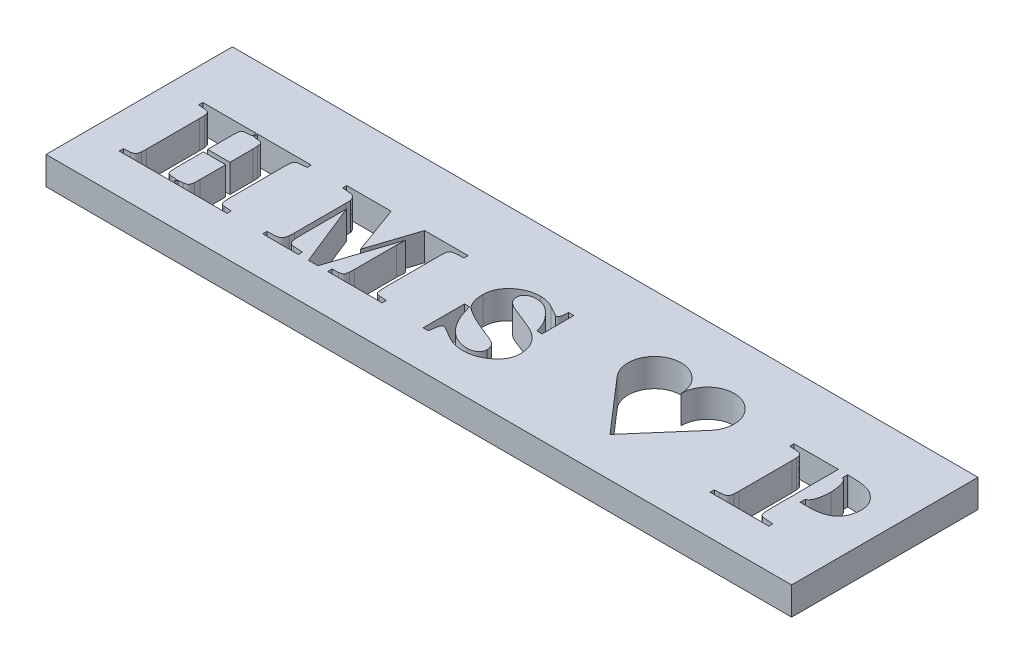
from build123d import *

# Parameters (mm, degrees)
SKETCH1_W           = 40
SKETCH1_H           = 10
BOSS_EXTRUDE1_DEPTH = 1.5
CUT_EXTRUDE1_START  = -1.5
CUT_EXTRUDE1_DEPTH  = 1.5
SKETCH4_W           = 0.5
SKETCH4_H           = 1.5
BOSS_EXTRUDE4_DEPTH = 3.5


# Read off the part's stored shape, not the designer's step: Cut-Extrude1
with BuildPart() as part:
    # Sketch1 → Boss-Extrude1 (new body)
    with BuildSketch(Plane(origin=(0, 0, 0), x_dir=(1, 0, 0), z_dir=(0, 1, 0))):
        Rectangle(SKETCH1_W, SKETCH1_H)
    extrude(amount=BOSS_EXTRUDE1_DEPTH)

    # Cut-Extrude1 outline → Cut-Extrude1 (cut)
    # profile 1 of 5: a face of its own
    with BuildSketch(Plane(origin=(0, 1.5, 0), x_dir=(1, 0, 0), z_dir=(0, 1, 0)).offset(CUT_EXTRUDE1_START)):
        with BuildLine():
            add(Edge.make_bspline(
                [(13.751780063, -2.651920037), (13.791225125, -2.646392107), (13.868290536, -2.635591968), (13.963177903, -2.624961797), (14.034165584, -2.614072675), (14.079340021, -2.59712884), (14.118712332, -2.57724694), (14.151816613, -2.549010475), (14.178865726, -2.510175688), (14.198441761, -2.457969123), (14.212947371, -2.392618841), (14.218633224, -2.344340467), (14.221716772, -2.31815817)],
                knots=[0, 0, 0, 0, 0.17998444, 0.351642879, 0.432127665, 0.503392336, 0.568787835, 0.630606754, 0.697953168, 0.780380817, 0.880896263, 1, 1, 1, 1], degree=3))
            Line((13.751780063, -2.651920037), (13.509691456, -2.651920037))
            Line((13.509691456, -2.651920037), (13.509691456, -2.879768138))
            Line((13.509691456, -2.879768138), (16.658623418, -2.879768138))
            Line((16.658623418, -2.879768138), (16.658623418, -2.665270511))
            add(Edge.make_bspline(
                [(15.896756329, -2.314598043), (15.900029258, -2.343182675), (15.906006646, -2.395387134), (15.922033115, -2.464765372), (15.939872112, -2.519211585), (15.96640644, -2.557948301), (15.999399172, -2.584460119), (16.038113328, -2.603640436), (16.083803584, -2.617942568), (16.155030415, -2.63008692), (16.252584508, -2.638699696), (16.377635211, -2.644398726), (16.514189019, -2.648443099), (16.608837664, -2.659470194), (16.658623418, -2.665270511)],
                knots=[0, 0, 0, 0, 0.089334166, 0.163152069, 0.221218087, 0.266243072, 0.306859461, 0.351400241, 0.399810796, 0.45515502, 0.575632115, 0.703973068, 0.844288063, 1, 1, 1, 1], degree=3))
            Line((15.896756329, -2.314598043), (15.885185918, -2.040468296))
            Line((15.885185918, -2.040468296), (15.886075949, -0.938609119))
            add(Edge.make_bspline(
                [(16.818829114, -0.931488866), (16.755933284, -0.93139613), (16.636667769, -0.931220281), (16.467563374, -0.932389361), (16.317740054, -0.933146761), (16.187798693, -0.93424693), (16.079200037, -0.934488299), (15.99377694, -0.936941916), (15.932055636, -0.937436976), (15.898832543, -0.93828392), (15.886075949, -0.938609119)],
                knots=[0, 0, 0, 0, 0.202279889, 0.383570981, 0.543871091, 0.684134449, 0.801498829, 0.893117146, 0.958960439, 1, 1, 1, 1], degree=3))
            add(Edge.make_bspline(
                [(18.392405063, 0.356386925), (18.391359033, 0.312138933), (18.389274149, 0.223946444), (18.373072447, 0.092814518), (18.344889972, -0.03622911), (18.307278625, -0.162464363), (18.258855092, -0.284066869), (18.192943887, -0.395101823), (18.116994611, -0.498734998), (18.025135353, -0.590083403), (17.922068452, -0.672028245), (17.806563482, -0.741921834), (17.680333857, -0.802133314), (17.5411882, -0.85024928), (17.386961757, -0.888123144), (17.214338527, -0.912476644), (17.022963582, -0.928887903), (16.888884315, -0.930596263), (16.818829114, -0.931488866)],
                knots=[0, 0, 0, 0, 0.057065209, 0.11373901, 0.17010708, 0.227250505, 0.283534078, 0.33840533, 0.393357922, 0.448830372, 0.504949787, 0.562836689, 0.62257612, 0.685026518, 0.752409338, 0.82709527, 0.909658846, 1, 1, 1, 1], degree=3))
            add(Edge.make_bspline(
                [(16.387163766, 1.625572052), (16.469945608, 1.624913788), (16.628464222, 1.623653282), (16.855657809, 1.613508842), (17.061355359, 1.594568677), (17.246101271, 1.570809093), (17.40911294, 1.538194509), (17.551189501, 1.498783864), (17.671978275, 1.451387525), (17.773139289, 1.395918911), (17.858199713, 1.335092928), (17.936129403, 1.275570618), (18.007028534, 1.215165002), (18.071983609, 1.154704685), (18.128557351, 1.092349215), (18.17918369, 1.0296029), (18.222653761, 0.965901907), (18.27101742, 0.880326964), (18.320012523, 0.771184349), (18.362070748, 0.635853255), (18.388006391, 0.497118847), (18.390936527, 0.40337153), (18.392405063, 0.356386925)],
                knots=[0, 0, 0, 0, 0.092479581, 0.177088773, 0.253965738, 0.323197368, 0.385077075, 0.439526139, 0.487716456, 0.529694894, 0.56803394, 0.604428348, 0.639227337, 0.672051015, 0.703486614, 0.733197595, 0.762062811, 0.789523871, 0.84293001, 0.895344802, 0.947548545, 1, 1, 1, 1], degree=3))
            Line((16.387163766, 1.625572052), (13.503461234, 1.620231862))
            Line((13.503461234, 1.620231862), (13.503461234, 1.395943887))
            add(Edge.make_bspline(
                [(14.221716772, 1.05150164), (14.218601565, 1.077662245), (14.212891484, 1.125613844), (14.198741768, 1.191427423), (14.176618553, 1.243448498), (14.14926121, 1.284474566), (14.113825655, 1.314112309), (14.072279487, 1.337527043), (14.022355586, 1.354069807), (13.947816379, 1.368062576), (13.854077188, 1.377926046), (13.742338101, 1.38398867), (13.62649742, 1.387438762), (13.546464322, 1.392971212), (13.503461234, 1.395943887)],
                knots=[0, 0, 0, 0, 0.086557298, 0.158656916, 0.220210345, 0.271308782, 0.318983879, 0.370480407, 0.427190938, 0.490838204, 0.619343219, 0.736492367, 0.858413057, 1, 1, 1, 1], degree=3))
            Line((14.221716772, 1.05150164), (14.234177215, 0.779151957))
            Line((14.234177215, 0.779151957), (14.234177215, -2.046698518))
            Line((14.234177215, -2.046698518), (14.221716772, -2.31815817))
        make_face()
        with BuildLine():
            add(Edge.make_bspline(
                [(16.740506329, 0.362617147), (16.73954769, 0.41665525), (16.737641431, 0.52411026), (16.720267257, 0.683599813), (16.691541946, 0.839952686), (16.659331847, 0.966407822), (16.629160988, 1.062645605), (16.602478831, 1.126131948), (16.574079163, 1.182597764), (16.542260027, 1.230244174), (16.508287391, 1.27090348), (16.470284743, 1.30168124), (16.430966476, 1.327467248), (16.344805585, 1.354362562), (16.213531576, 1.378895478), (16.070165314, 1.388449725), (15.969450131, 1.39059354), (15.91929289, 1.391090136), (15.894382169, 1.392060277), (15.886075949, 1.392383761)],
                knots=[0, 0, 0, 0, 0.101326501, 0.201488203, 0.300479219, 0.399268288, 0.446075168, 0.489477233, 0.52830041, 0.564413111, 0.5967631, 0.627184468, 0.655909756, 0.684244353, 0.795444025, 0.905934202, 0.953244414, 0.984409838, 1, 1, 1, 1], degree=3))
            add(Edge.make_bspline(
                [(15.886075949, -0.715211176), (15.889919625, -0.714242435), (15.902735991, -0.711012261), (15.930021835, -0.709767113), (15.972052886, -0.706535221), (16.028269116, -0.704893573), (16.096480571, -0.699009607), (16.174988646, -0.691657574), (16.262027697, -0.67797164), (16.34011759, -0.667229382), (16.404213234, -0.65079373), (16.450672732, -0.630113232), (16.493104572, -0.6000436), (16.531117921, -0.561219349), (16.566346402, -0.514872784), (16.598348392, -0.460660381), (16.62543019, -0.397514752), (16.659148084, -0.302057525), (16.691437673, -0.170923464), (16.719714365, -0.003417998), (16.738152488, 0.175598833), (16.73970666, 0.29908154), (16.740506329, 0.362617147)],
                knots=[0, 0, 0, 0, 0.007235509, 0.024126103, 0.049667218, 0.084414085, 0.126840348, 0.17481383, 0.228501197, 0.287880137, 0.318797379, 0.349138474, 0.380283191, 0.413262574, 0.448081315, 0.486494571, 0.528013384, 0.573468444, 0.67146271, 0.774351508, 0.883896991, 1, 1, 1, 1], degree=3))
            Line((15.886075949, -0.715211176), (15.886075949, 1.392383761))
        make_face(mode=Mode.SUBTRACT)
    # profile 2 of 5: a face of its own
    with BuildSketch(Plane(origin=(0, 1.5, 0), x_dir=(1, 0, 0), z_dir=(0, 1, 0)).offset(CUT_EXTRUDE1_START)):
        with BuildLine():
            add(Edge.make_bspline(
                [(-0.746835443, 0.993649584), (-0.74536001, 0.95842561), (-0.74249664, 0.890066537), (-0.71357404, 0.793357329), (-0.668669437, 0.705995609), (-0.603755642, 0.631635803), (-0.527420634, 0.567156181), (-0.445570191, 0.506667308), (-0.356004261, 0.454420477), (-0.25734597, 0.407073125), (-0.144667653, 0.360479114), (-0.013883882, 0.308281701), (0.137444834, 0.248222158), (0.308051562, 0.183948023), (0.491479239, 0.113524641), (0.6810593, 0.035060839), (0.873906708, -0.049940556), (1.036966169, -0.123406026), (1.166770258, -0.18671078), (1.260009579, -0.241691302), (1.34885612, -0.302101642), (1.433592047, -0.368097492), (1.513873299, -0.439441978), (1.589901358, -0.516508727), (1.661850119, -0.598899601), (1.728524322, -0.686893583), (1.788876412, -0.779372907), (1.843064278, -0.875473692), (1.886977569, -0.976281789), (1.924099957, -1.080248302), (1.952159892, -1.187816566), (1.97315274, -1.29897335), (1.984349061, -1.413952778), (1.986335531, -1.491890867), (1.987341772, -1.531370195)],
                knots=[0, 0, 0, 0, 0.026271138, 0.050984329, 0.074800032, 0.099199579, 0.124200839, 0.149448905, 0.175206422, 0.201598111, 0.231222891, 0.266362204, 0.306898554, 0.352960473, 0.402685656, 0.453811837, 0.506362542, 0.560266849, 0.587549755, 0.614297078, 0.64112432, 0.667838504, 0.694551766, 0.721376256, 0.748735718, 0.776288763, 0.803854307, 0.831262293, 0.858674767, 0.885968494, 0.913734162, 0.941711718, 0.970474228, 1, 1, 1, 1], degree=3))
            add(Edge.make_bspline(
                [(-0.202136076, 1.449345786), (-0.234013839, 1.447723663), (-0.298004884, 1.444467432), (-0.39279841, 1.420267455), (-0.484917774, 1.380392708), (-0.572263029, 1.327489082), (-0.649550989, 1.262385069), (-0.706636807, 1.18288901), (-0.741484666, 1.091590917), (-0.745019546, 1.026888002), (-0.746835443, 0.993649584)],
                knots=[0, 0, 0, 0, 0.121610338, 0.244119151, 0.370969357, 0.503632024, 0.632866389, 0.753858137, 0.873554906, 1, 1, 1, 1], degree=3))
            add(Edge.make_bspline(
                [(1.374109968, -0.031666872), (1.366252482, -0.00491851), (1.349324649, 0.052707016), (1.318896671, 0.143670451), (1.282854018, 0.245684404), (1.242135678, 0.359117718), (1.187943269, 0.483058575), (1.111420705, 0.613435213), (1.012804652, 0.750848998), (0.897967234, 0.891908944), (0.774700527, 1.027880985), (0.647559053, 1.146348937), (0.522471806, 1.244702954), (0.394835115, 1.321584863), (0.261617118, 1.380230712), (0.117943026, 1.420972334), (-0.038145377, 1.44510274), (-0.146272122, 1.447900379), (-0.202136076, 1.449345786)],
                knots=[0, 0, 0, 0, 0.035906866, 0.077356214, 0.123523959, 0.175272454, 0.232580615, 0.297470079, 0.369568945, 0.450258278, 0.531668307, 0.605756047, 0.673860524, 0.736251134, 0.797168506, 0.860787532, 0.92807553, 1, 1, 1, 1], degree=3))
            Line((1.374109968, -0.031666872), (1.64556962, -0.031666872))
            Line((1.64556962, -0.031666872), (1.64556962, 1.677193887))
            Line((1.64556962, 1.677193887), (1.360759494, 1.677193887))
            add(Edge.make_bspline(
                [(1.178303006, 1.164535659), (1.192872855, 1.16611171), (1.222179591, 1.169281879), (1.261974291, 1.195146357), (1.293186389, 1.236979688), (1.318646727, 1.293485071), (1.337323053, 1.366025505), (1.351001358, 1.454845522), (1.35973843, 1.56042975), (1.360403904, 1.636530286), (1.360759494, 1.677193887)],
                knots=[0, 0, 0, 0, 0.073703244, 0.148251473, 0.233102023, 0.336401283, 0.461618154, 0.612966137, 0.793192121, 1, 1, 1, 1], degree=3))
            Line((1.178303006, 1.164535659), (0.583761867, 1.497407495))
            add(Edge.make_bspline(
                [(-0.151404272, 1.677193887), (-0.088669325, 1.674811072), (0.036760548, 1.670046961), (0.223461219, 1.636204065), (0.407108198, 1.579076769), (0.524376168, 1.524862271), (0.583761867, 1.497407495)],
                knots=[0, 0, 0, 0, 0.246456156, 0.49275509, 0.74312599, 1, 1, 1, 1], degree=3))
            add(Edge.make_bspline(
                [(-1.772151899, 0.21309183), (-1.770584598, 0.263318996), (-1.767488695, 0.362533112), (-1.743736956, 0.508230636), (-1.705228705, 0.648151664), (-1.65210364, 0.782405892), (-1.581383277, 0.909612003), (-1.496616821, 1.031214238), (-1.395830924, 1.146385972), (-1.282070313, 1.254886716), (-1.157864776, 1.35293449), (-1.028274161, 1.440388709), (-0.893451668, 1.513453288), (-0.754060649, 1.57338875), (-0.609880315, 1.620170959), (-0.46104509, 1.652343669), (-0.307809254, 1.674269383), (-0.203994346, 1.676210543), (-0.151404272, 1.677193887)],
                knots=[0, 0, 0, 0, 0.062204273, 0.122872591, 0.182349013, 0.241728823, 0.301276751, 0.362251589, 0.425042733, 0.490555683, 0.556740526, 0.620861198, 0.684017035, 0.74641971, 0.80860552, 0.871475145, 0.934892476, 1, 1, 1, 1], degree=3))
            add(Edge.make_bspline(
                [(-1.299545095, -0.858506271), (-1.337294966, -0.833309104), (-1.412645338, -0.783014473), (-1.50885915, -0.685490655), (-1.592233855, -0.574408744), (-1.657649818, -0.445982441), (-1.709456485, -0.303075208), (-1.746267496, -0.144762208), (-1.768712504, 0.029100011), (-1.770974832, 0.150124171), (-1.772151899, 0.21309183)],
                knots=[0, 0, 0, 0, 0.110755835, 0.221073428, 0.333112562, 0.449304402, 0.572116466, 0.704119735, 0.846056458, 1, 1, 1, 1], degree=3))
            add(Edge.make_bspline(
                [(0.905063291, -2.25318586), (0.903638351, -2.215668361), (0.900927406, -2.144291419), (0.87744058, -2.04314882), (0.838314346, -1.954006155), (0.779669218, -1.875399333), (0.699005258, -1.803819236), (0.591835205, -1.736708201), (0.458422197, -1.666880931), (0.29850886, -1.600971646), (0.122358616, -1.531570348), (-0.062505211, -1.457751458), (-0.25350044, -1.380752915), (-0.451637308, -1.301633817), (-0.656204154, -1.21307565), (-0.86491792, -1.107577365), (-1.081888599, -0.990930949), (-1.225767948, -0.903393123), (-1.299545095, -0.858506271)],
                knots=[0, 0, 0, 0, 0.041215804, 0.078412958, 0.113463202, 0.147527654, 0.185409671, 0.231382499, 0.286256452, 0.350862845, 0.421448381, 0.494517961, 0.569768794, 0.647928615, 0.729160766, 0.814813628, 0.905041812, 1, 1, 1, 1], degree=3))
            add(Edge.make_bspline(
                [(0.299841772, -2.708882062), (0.342972755, -2.707136062), (0.425856079, -2.703780833), (0.543912079, -2.679370402), (0.648605233, -2.635925879), (0.738241526, -2.576467933), (0.811054726, -2.505819446), (0.865750025, -2.428129845), (0.898890077, -2.342617796), (0.902996322, -2.283130238), (0.905063291, -2.25318586)],
                knots=[0, 0, 0, 0, 0.153956857, 0.295853595, 0.427853137, 0.556237336, 0.677585662, 0.788058432, 0.893314524, 1, 1, 1, 1], degree=3))
            add(Edge.make_bspline(
                [(-1.56210443, -0.715211176), (-1.553270159, -0.745491974), (-1.534105484, -0.811181788), (-1.501464417, -0.917420743), (-1.465370947, -1.039860605), (-1.42450843, -1.178196528), (-1.37192461, -1.330019444), (-1.299271269, -1.491990632), (-1.210706271, -1.665713384), (-1.107591439, -1.847655387), (-0.987903058, -2.027571665), (-0.847811739, -2.19235002), (-0.69200729, -2.339964983), (-0.549798186, -2.448814862), (-0.428537427, -2.524803854), (-0.333637698, -2.573597317), (-0.236172142, -2.616333518), (-0.134868267, -2.649265996), (-0.030741784, -2.67691872), (0.07685647, -2.694798257), (0.187409631, -2.707156805), (0.26212859, -2.708303358), (0.299841772, -2.708882062)],
                knots=[0, 0, 0, 0, 0.032058659, 0.069546626, 0.112955303, 0.161793716, 0.216152654, 0.276098588, 0.342040466, 0.414297442, 0.48856181, 0.561299738, 0.633604513, 0.706334941, 0.742899623, 0.77890806, 0.814699962, 0.850933678, 0.887061852, 0.924092282, 0.96168681, 1, 1, 1, 1], degree=3))
            Line((-1.56210443, -0.715211176), (-1.829113924, -0.715211176))
            Line((-1.829113924, -0.715211176), (-1.829113924, -2.936730163))
            Line((-1.829113924, -2.936730163), (-1.552314082, -2.936730163))
            add(Edge.make_bspline(
                [(-1.321795886, -2.310147885), (-1.338073421, -2.311374451), (-1.369558207, -2.313746935), (-1.412760509, -2.336774587), (-1.444107136, -2.376220962), (-1.463878713, -2.417990381), (-1.475933731, -2.460596388), (-1.485384881, -2.502597884), (-1.496249944, -2.553247493), (-1.506778845, -2.612934215), (-1.517041751, -2.681285437), (-1.529114278, -2.758308481), (-1.540198542, -2.844458415), (-1.548146251, -2.904988032), (-1.552314082, -2.936730163)],
                knots=[0, 0, 0, 0, 0.06776762, 0.131079364, 0.198000285, 0.275177456, 0.323096399, 0.383019194, 0.455330472, 0.539828243, 0.636570394, 0.74454424, 0.866037313, 1, 1, 1, 1], degree=3))
            add(Edge.make_bspline(
                [(0.282041139, -2.936730163), (0.237508146, -2.935551227), (0.148815224, -2.933203232), (0.016001476, -2.918915356), (-0.115270458, -2.893514907), (-0.246390826, -2.859933425), (-0.375731015, -2.814942338), (-0.504849579, -2.76169424), (-0.631898955, -2.697034862), (-0.755523834, -2.625245695), (-0.870499752, -2.552069173), (-0.976400028, -2.489246695), (-1.067169195, -2.434455229), (-1.14524722, -2.391457136), (-1.20783822, -2.355408793), (-1.258281757, -2.332272507), (-1.293755696, -2.314709063), (-1.314300334, -2.311367154), (-1.321795886, -2.310147885)],
                knots=[0, 0, 0, 0, 0.076481606, 0.152322503, 0.229061601, 0.305922368, 0.38454598, 0.464023294, 0.54559101, 0.629131657, 0.709435825, 0.779596701, 0.84058432, 0.891454838, 0.93272505, 0.964398351, 0.987011014, 1, 1, 1, 1], degree=3))
            add(Edge.make_bspline(
                [(1.987341772, -1.531370195), (1.985889377, -1.580423199), (1.983017973, -1.677401568), (1.957566251, -1.819563196), (1.914950031, -1.955226142), (1.857569739, -2.085513714), (1.780003914, -2.20752681), (1.689466899, -2.325591288), (1.579158782, -2.434722839), (1.455991692, -2.537447141), (1.322976705, -2.631107563), (1.183562844, -2.711618471), (1.042231431, -2.781940443), (0.896631239, -2.837973497), (0.748075375, -2.88311554), (0.595436233, -2.913710723), (0.439789758, -2.933256171), (0.334908417, -2.935565903), (0.282041139, -2.936730163)],
                knots=[0, 0, 0, 0, 0.060199253, 0.119014636, 0.176627426, 0.234515987, 0.29325121, 0.353735287, 0.416847988, 0.483315961, 0.55052655, 0.616320213, 0.68083878, 0.744161416, 0.807668221, 0.871255433, 0.935104045, 1, 1, 1, 1], degree=3))
        make_face()
    # profile 3 of 5: a face of its own
    with BuildSketch(Plane(origin=(0, 1.5, 0), x_dir=(1, 0, 0), z_dir=(0, 1, 0)).offset(CUT_EXTRUDE1_START)):
        with BuildLine():
            add(Edge.make_bspline(
                [(-9.394382911, -2.261196144), (-9.390783184, -2.290650787), (-9.384109705, -2.345256293), (-9.366900942, -2.419943902), (-9.343187202, -2.48093864), (-9.312602866, -2.529553931), (-9.272719052, -2.565850424), (-9.22577697, -2.5935624), (-9.169843227, -2.613431253), (-9.129307552, -2.61996902), (-9.107792722, -2.623439024)],
                knots=[0, 0, 0, 0, 0.173653238, 0.321933046, 0.447391543, 0.555296573, 0.65484072, 0.759984849, 0.872608873, 1, 1, 1, 1], degree=3))
            Line((-9.394382911, -2.261196144), (-9.405953323, -1.976386018))
            Line((-9.405953323, -1.976386018), (-9.405141196, 0.525775601))
            Line((-9.405141196, 0.525775601), (-8.042424842, -2.879768138))
            Line((-8.042424842, -2.879768138), (-7.537776899, -2.879768138))
            Line((-7.537776899, -2.879768138), (-6.459948576, 0.383087875))
            Line((-6.459948576, 0.383087875), (-6.366492452, 0.6579588))
            add(Edge.make_bspline(
                [(-6.386075949, 0.185500849), (-6.385966673, 0.218732433), (-6.385739278, 0.287884175), (-6.381591194, 0.395572194), (-6.376669589, 0.511322839), (-6.370539677, 0.599623584), (-6.367089402, 0.649405018), (-6.366492452, 0.6579588)],
                knots=[0, 0, 0, 0, 0.114920202, 0.239137934, 0.372664128, 0.515581263, 0.545234724, 0.545234724, 0.545234724, 0.545234724], degree=3))
            Line((-6.386075949, 0.185500849), (-6.386075949, -2.052038708))
            Line((-6.386075949, -2.052038708), (-6.397646361, -2.326168454))
            add(Edge.make_bspline(
                [(-6.678006329, -2.635009435), (-6.652067274, -2.631506209), (-6.605061195, -2.625157754), (-6.543143429, -2.607893217), (-6.495291351, -2.589623243), (-6.459407089, -2.563762072), (-6.437095992, -2.524374301), (-6.418650145, -2.473172967), (-6.406907234, -2.404786245), (-6.400933303, -2.354072104), (-6.397646361, -2.326168454)],
                knots=[0, 0, 0, 0, 0.163707455, 0.296666386, 0.401561892, 0.483683985, 0.567181473, 0.680033902, 0.823950054, 1, 1, 1, 1], degree=3))
            Line((-6.678006329, -2.635009435), (-7.004647943, -2.656370195))
            Line((-7.004647943, -2.656370195), (-7.004647943, -2.879768138))
            Line((-7.004647943, -2.879768138), (-4.088014241, -2.879768138))
            Line((-4.088014241, -2.879768138), (-4.088014241, -2.660820353))
            Line((-4.088014241, -2.660820353), (-4.492088608, -2.628779214))
            add(Edge.make_bspline(
                [(-4.724386867, -2.31281798), (-4.721386393, -2.34167588), (-4.715905204, -2.394392737), (-4.700953802, -2.464419993), (-4.683987901, -2.518427886), (-4.662364295, -2.558618286), (-4.631337663, -2.58582061), (-4.592835692, -2.604816668), (-4.545742057, -2.620078222), (-4.51089426, -2.625729497), (-4.492088608, -2.628779214)],
                knots=[0, 0, 0, 0, 0.19690421, 0.359699451, 0.485203268, 0.580911852, 0.665067415, 0.760584985, 0.870799419, 1, 1, 1, 1], degree=3))
            Line((-4.724386867, -2.31281798), (-4.735067247, -2.037798201))
            Line((-4.735067247, -2.037798201), (-4.734177215, 0.8619249))
            Line((-4.734177215, 0.8619249), (-4.724386867, 1.077312558))
            add(Edge.make_bspline(
                [(-4.232199367, 1.392383761), (-4.242587625, 1.392184308), (-4.268153352, 1.391693451), (-4.313263674, 1.387697337), (-4.372504947, 1.380966417), (-4.441325305, 1.374466318), (-4.51065137, 1.363564741), (-4.571704893, 1.349942896), (-4.618850992, 1.329395722), (-4.656153669, 1.304248888), (-4.6815141, 1.266041589), (-4.70011188, 1.216171792), (-4.714890366, 1.151762824), (-4.721009359, 1.103791405), (-4.724386867, 1.077312558)],
                knots=[0, 0, 0, 0, 0.046034389, 0.113291624, 0.200550599, 0.310312985, 0.419467395, 0.511620618, 0.586375576, 0.646595457, 0.707882266, 0.785762784, 0.881747206, 1, 1, 1, 1], degree=3))
            Line((-4.232199367, 1.392383761), (-3.97943038, 1.392383761))
            Line((-3.97943038, 1.392383761), (-3.97943038, 1.620231862))
            Line((-3.97943038, 1.620231862), (-6.308643196, 1.620231862))
            Line((-6.308643196, 1.620231862), (-7.158623418, -0.967980163))
            Line((-7.158623418, -0.967980163), (-8.103837025, 1.620231862))
            Line((-8.103837025, 1.620231862), (-10.487341772, 1.620231862))
            Line((-10.487341772, 1.620231862), (-10.487341772, 1.397723951))
            add(Edge.make_bspline(
                [(-9.701443829, 1.047941514), (-9.708158775, 1.068262827), (-9.721371436, 1.108248055), (-9.74759381, 1.164254744), (-9.780680367, 1.21373942), (-9.816534533, 1.258364122), (-9.857882945, 1.296909669), (-9.905616879, 1.325969597), (-9.957967284, 1.348323708), (-10.035013064, 1.36289366), (-10.134005242, 1.373829734), (-10.253247261, 1.380874899), (-10.371162334, 1.387172193), (-10.448790387, 1.394222601), (-10.487341772, 1.397723951)],
                knots=[0, 0, 0, 0, 0.06814184, 0.134079279, 0.1961954, 0.257296956, 0.316158012, 0.375155444, 0.434469865, 0.496377191, 0.623900921, 0.751753331, 0.876716566, 1, 1, 1, 1], degree=3))
            Line((-9.701443829, 1.047941514), (-9.689873418, 0.785382178))
            Line((-9.689873418, 0.785382178), (-9.689873418, -1.980836176))
            Line((-9.689873418, -1.980836176), (-9.702333861, -2.265646303))
            add(Edge.make_bspline(
                [(-10.499802215, -2.656370195), (-10.455020611, -2.653374172), (-10.372612604, -2.647860831), (-10.25228625, -2.644651974), (-10.133232416, -2.636761794), (-10.029416923, -2.627634191), (-9.943697327, -2.610332429), (-9.884600016, -2.588654419), (-9.833866076, -2.557361702), (-9.791231816, -2.517621995), (-9.756620013, -2.467841933), (-9.730518042, -2.408868795), (-9.711503574, -2.34047336), (-9.705511836, -2.291579344), (-9.702333861, -2.265646303)],
                knots=[0, 0, 0, 0, 0.13348818, 0.245647628, 0.357942385, 0.488430381, 0.555241526, 0.617522313, 0.674582857, 0.731397213, 0.789666415, 0.85364336, 0.922373468, 1, 1, 1, 1], degree=3))
            Line((-10.499802215, -2.656370195), (-10.499802215, -2.879768138))
            Line((-10.499802215, -2.879768138), (-8.586234177, -2.879768138))
            Line((-8.586234177, -2.879768138), (-8.586234177, -2.659930322))
            Line((-8.586234177, -2.659930322), (-9.107792722, -2.623439024))
        make_face()
    # profile 4 of 5: a face of its own
    with BuildSketch(Plane(origin=(0, 1.5, 0), x_dir=(1, 0, 0), z_dir=(0, 1, 0)).offset(CUT_EXTRUDE1_START)):
        with BuildLine():
            add(Edge.make_bspline(
                [(-15.887163766, -2.324388391), (-15.88661012, -2.354096533), (-15.885615228, -2.407481592), (-15.876092147, -2.478284757), (-15.862580703, -2.531722201), (-15.840028759, -2.570620277), (-15.805496256, -2.593800561), (-15.763680793, -2.611172241), (-15.711541902, -2.625193829), (-15.673039494, -2.630984502), (-15.652195411, -2.634119404)],
                knots=[0, 0, 0, 0, 0.196707415, 0.353480103, 0.472275171, 0.560613516, 0.643561442, 0.74215054, 0.860407813, 1, 1, 1, 1], degree=3))
            Line((-15.887163766, -2.324388391), (-15.899624209, -2.044028423))
            Line((-15.899624209, -2.044028423), (-15.898734177, -0.658249151))
            Line((-15.898734177, -0.658249151), (-14.702531646, -0.658249151))
            Line((-14.702531646, -0.658249151), (-14.702531646, -2.044918454))
            Line((-14.702531646, -2.044918454), (-14.714992089, -2.322608328))
            add(Edge.make_bspline(
                [(-15.001582278, -2.634119404), (-14.975088094, -2.630512991), (-14.926695955, -2.623925807), (-14.862529547, -2.607628229), (-14.81380472, -2.587634235), (-14.776593293, -2.562021346), (-14.753440151, -2.522255718), (-14.736625188, -2.470161899), (-14.722599912, -2.402068732), (-14.717697467, -2.35086483), (-14.714992089, -2.322608328)],
                knots=[0, 0, 0, 0, 0.164595913, 0.300637613, 0.40618912, 0.488400851, 0.573033149, 0.683392263, 0.825282312, 1, 1, 1, 1], degree=3))
            Line((-15.001582278, -2.634119404), (-15.27304193, -2.657260227))
            Line((-15.27304193, -2.657260227), (-15.27304193, -2.879768138))
            Line((-15.27304193, -2.879768138), (-12.404469937, -2.879768138))
            Line((-12.404469937, -2.879768138), (-12.404469937, -2.660820353))
            Line((-12.404469937, -2.660820353), (-12.793413766, -2.630559277))
            add(Edge.make_bspline(
                [(-13.039952532, -2.31815817), (-13.036946427, -2.347023814), (-13.031521498, -2.399115823), (-13.016875148, -2.468352375), (-13.0019458, -2.521788281), (-12.979348753, -2.560931128), (-12.947054318, -2.587111254), (-12.905632408, -2.605948226), (-12.853686546, -2.622225913), (-12.81461138, -2.627628478), (-12.793413766, -2.630559277)],
                knots=[0, 0, 0, 0, 0.192076942, 0.346629144, 0.468439447, 0.558431583, 0.640711966, 0.739148355, 0.858492413, 1, 1, 1, 1], degree=3))
            Line((-13.039952532, -2.31815817), (-13.051522943, -2.045808486))
            Line((-13.051522943, -2.045808486), (-13.050632911, 0.826323634))
            Line((-13.050632911, 0.826323634), (-13.039952532, 1.05684183))
            add(Edge.make_bspline(
                [(-12.809434335, 1.368352906), (-12.82678105, 1.365681812), (-12.859742987, 1.360606243), (-12.904375329, 1.344298132), (-12.942031964, 1.323772882), (-12.973774882, 1.296815524), (-12.998230381, 1.257291005), (-13.01654358, 1.204198856), (-13.031443835, 1.135765535), (-13.036937211, 1.084810899), (-13.039952532, 1.05684183)],
                knots=[0, 0, 0, 0, 0.121360463, 0.230607127, 0.327250476, 0.417564353, 0.515640177, 0.645088798, 0.805188763, 1, 1, 1, 1], degree=3))
            Line((-12.809434335, 1.368352906), (-12.392009494, 1.400394046))
            Line((-12.392009494, 1.400394046), (-12.392009494, 1.620231862))
            Line((-12.392009494, 1.620231862), (-15.27304193, 1.620231862))
            Line((-15.27304193, 1.620231862), (-15.27304193, 1.396833919))
            Line((-15.27304193, 1.396833919), (-15.001582278, 1.374583128))
            add(Edge.make_bspline(
                [(-14.714992089, 1.073752432), (-14.717781075, 1.100211011), (-14.722863904, 1.148430847), (-14.736230167, 1.213390793), (-14.755386274, 1.263086825), (-14.779833083, 1.301777767), (-14.817267052, 1.328100202), (-14.8659204, 1.34892689), (-14.929216973, 1.364002081), (-14.976007103, 1.370843599), (-15.001582278, 1.374583128)],
                knots=[0, 0, 0, 0, 0.168055448, 0.306275169, 0.417285206, 0.50357084, 0.590525443, 0.701266249, 0.836714108, 1, 1, 1, 1], degree=3))
            Line((-14.714992089, 1.073752432), (-14.702531646, 0.805852906))
            Line((-14.702531646, 0.805852906), (-14.702531646, -0.430401049))
            Line((-14.702531646, -0.430401049), (-15.898734177, -0.430401049))
            Line((-15.898734177, -0.430401049), (-15.898734177, 0.84590433))
            Line((-15.898734177, 0.84590433), (-15.887163766, 1.076422527))
            add(Edge.make_bspline(
                [(-15.653975475, 1.374583128), (-15.674811462, 1.37207573), (-15.713300338, 1.367443988), (-15.765333061, 1.354590643), (-15.806895732, 1.336816984), (-15.840689669, 1.312828954), (-15.863117639, 1.274512815), (-15.877240936, 1.222713231), (-15.885119672, 1.154975869), (-15.886437556, 1.104330355), (-15.887163766, 1.076422527)],
                knots=[0, 0, 0, 0, 0.142311329, 0.262881868, 0.36199024, 0.448132688, 0.538587183, 0.656370766, 0.810645699, 1, 1, 1, 1], degree=3))
            Line((-15.653975475, 1.374583128), (-15.328223892, 1.401284077))
            Line((-15.328223892, 1.401284077), (-15.328223892, 1.620231862))
            Line((-15.328223892, 1.620231862), (-18.209256329, 1.620231862))
            Line((-18.209256329, 1.620231862), (-18.209256329, 1.396833919))
            Line((-18.209256329, 1.396833919), (-17.860363924, 1.37013297))
            add(Edge.make_bspline(
                [(-17.563093354, 1.05684183), (-17.566278463, 1.083288241), (-17.572114107, 1.131742427), (-17.585295702, 1.197607264), (-17.604685902, 1.248916399), (-17.628664957, 1.289847186), (-17.665641583, 1.319818643), (-17.716922683, 1.3408045), (-17.782847658, 1.35953039), (-17.832926603, 1.366380127), (-17.860363924, 1.37013297)],
                knots=[0, 0, 0, 0, 0.162394421, 0.297533361, 0.408016985, 0.495807726, 0.583094185, 0.692342652, 0.831440274, 1, 1, 1, 1], degree=3))
            Line((-17.563093354, 1.05684183), (-17.550632911, 0.785382178))
            Line((-17.550632911, 0.785382178), (-17.550632911, -2.046698518))
            Line((-17.550632911, -2.046698518), (-17.563093354, -2.317268138))
            add(Edge.make_bspline(
                [(-17.845233386, -2.628779214), (-17.821357263, -2.624958533), (-17.777164319, -2.617886736), (-17.71793914, -2.599119644), (-17.67008328, -2.576704803), (-17.633282481, -2.546275368), (-17.606223354, -2.505812097), (-17.586585747, -2.454093223), (-17.571798582, -2.389971126), (-17.566157743, -2.34286083), (-17.563093354, -2.317268138)],
                knots=[0, 0, 0, 0, 0.153337732, 0.283816832, 0.393342131, 0.486931964, 0.583084326, 0.698878596, 0.836415644, 1, 1, 1, 1], degree=3))
            Line((-17.845233386, -2.628779214), (-18.196795886, -2.657260227))
            Line((-18.196795886, -2.657260227), (-18.196795886, -2.879768138))
            Line((-18.196795886, -2.879768138), (-15.328223892, -2.879768138))
            Line((-15.328223892, -2.879768138), (-15.328223892, -2.661710385))
            Line((-15.328223892, -2.661710385), (-15.652195411, -2.634119404))
        make_face()
    # profile 5 of 5: a face of its own
    with BuildSketch(Plane(origin=(0, 1.5, 0), x_dir=(1, 0, 0), z_dir=(0, 1, 0)).offset(CUT_EXTRUDE1_START)):
        with BuildLine():
            ThreePointArc((8.13996494, 0.933943964), (6.217246732, 2.268280718), (5.63996494, 0.000231862))
            Line((5.63996494, 0.000231862), (8.13996494, -2.879768138))
            Line((8.13996494, -2.879768138), (10.63996494, 0.000231862))
            ThreePointArc((10.63996494, 0.000231862), (10.062683148, 2.268280718), (8.13996494, 0.933943964))
        make_face()
    extrude(amount=CUT_EXTRUDE1_DEPTH, mode=Mode.SUBTRACT)

    # Sketch4 → Boss-Extrude4 (add)
    with BuildSketch(Plane(origin=(-0.002954111, 0, -1.595219982), x_dir=(0.9999982853267696, 0, -0.0018518486765310529), z_dir=(0.0018518486765310529, 0, 0.9999982853267696))):
        with Locations((16.138627194, 0.75)):
            Rectangle(SKETCH4_W, SKETCH4_H)
    extrude(amount=BOSS_EXTRUDE4_DEPTH)


solid = part.part
